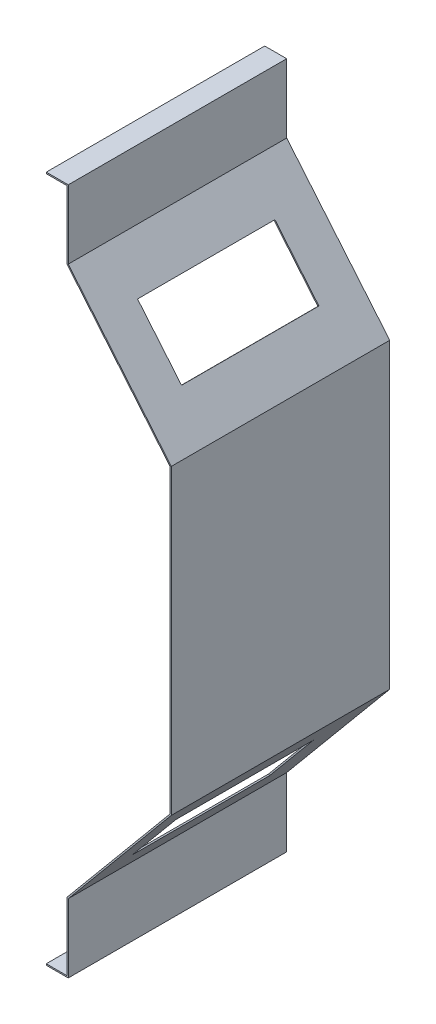
from build123d import *

# Parameters (mm, degrees)
BOSS_EXTRUDE1_DEPTH = 159
SKETCH2_W           = 100
SKETCH2_H           = 50
CUT_EXTRUDE1_DEPTH  = 160
SKETCH5_W           = 100
SKETCH5_H           = 50
CUT_EXTRUDE2_DEPTH  = 160


with BuildPart() as part:
    # Sketch1 → Boss-Extrude1 (new body)
    with BuildSketch(Plane.XY):
        Polygon((0, 110), (0, -110), (-75, -200), (-75, -249), (-75, -250), (-91, -250), (-91, -249), (-76, -249), (-76, -199.637950065), (-1, -109.637950065), (-1, 109.637950065), (-76, 199.637950065), (-76, 249), (-91, 249), (-91, 250), (-75, 250), (-75, 249), (-75, 200), align=None)
    extrude(amount=BOSS_EXTRUDE1_DEPTH)

    # Sketch2 → Cut-Extrude1 (cut)
    with BuildSketch(Plane(origin=(54.098360656, -45.081967213, 0), x_dir=(0, 0, -1), z_dir=(0.7682212795973745, -0.6401843996644814, 0))):
        with Locations((-84, -143.004340756)):
            Rectangle(SKETCH2_W, SKETCH2_H)
    extrude(amount=-CUT_EXTRUDE1_DEPTH, mode=Mode.SUBTRACT)

    # Sketch5 → Cut-Extrude2 (cut)
    with BuildSketch(Plane(origin=(54.098360656, 45.081967213, 0), x_dir=(0, 0, -1), z_dir=(0.7682212795973775, 0.640184399664478, 0))):
        with Locations((-80, 143.158085894)):
            Rectangle(SKETCH5_W, SKETCH5_H)
    extrude(amount=-CUT_EXTRUDE2_DEPTH, mode=Mode.SUBTRACT)


solid = part.part
